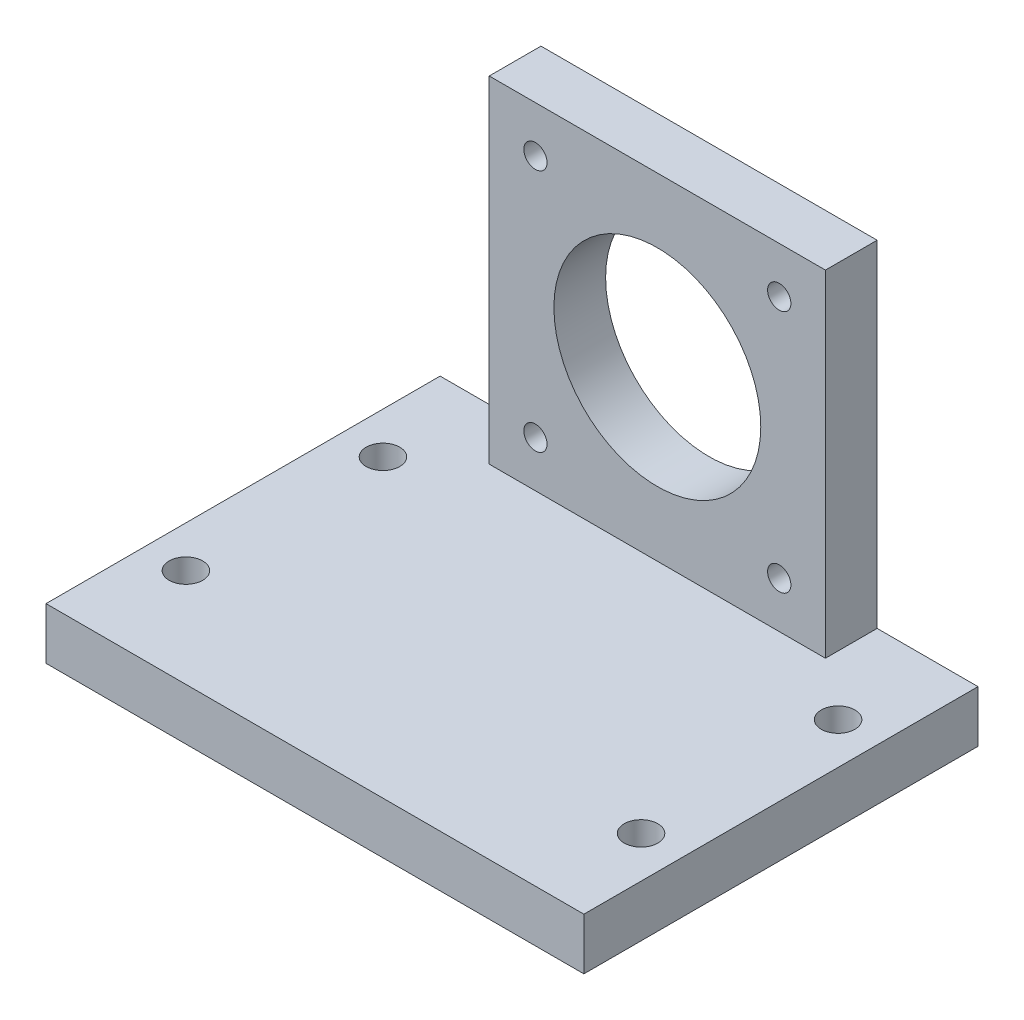
from build123d import *

# Parameters (mm, degrees)
SKETCH1_W                = 65
SKETCH1_H                = 65
SKETCH1_R                = 20
SKETCH1_R_2              = 2.25
BOSS_EXTRUDE1_DEPTH      = 10
BOSS_EXTRUDE2_DEPTH      = 66.2
BOSS_EXTRUDE2_DEPTH_BACK = 10
SKETCH3_R                = 3.25
CUT_EXTRUDE1_DEPTH       = 119.892556537


with BuildPart() as part:
    # Sketch1 → Boss-Extrude1 (new body)
    with BuildSketch(Plane.XY):
        Rectangle(SKETCH1_W, SKETCH1_H)
        Circle(SKETCH1_R, mode=Mode.SUBTRACT)
        with Locations((23.57, 23.57)):
            Circle(SKETCH1_R_2, mode=Mode.SUBTRACT)
        with Locations((-23.57, 23.57)):
            Circle(SKETCH1_R_2, mode=Mode.SUBTRACT)
        with Locations((-23.57, -23.57)):
            Circle(SKETCH1_R_2, mode=Mode.SUBTRACT)
        with Locations((23.57, -23.57)):
            Circle(SKETCH1_R_2, mode=Mode.SUBTRACT)
    extrude(amount=BOSS_EXTRUDE1_DEPTH)

    # Sketch2 → Boss-Extrude2 (add, two sides: drawn at the far end of the back side and taken through both)
    with BuildSketch(Plane.XY.offset(10).offset(-BOSS_EXTRUDE2_DEPTH_BACK)):
        Polygon((0, -32.5), (-52, -32.5), (-52, -42.5), (52, -42.5), (52, -32.5), align=None)
    extrude(amount=BOSS_EXTRUDE2_DEPTH + BOSS_EXTRUDE2_DEPTH_BACK)

    # Sketch3 → Cut-Extrude1 (cut, through all)
    with BuildSketch(Plane.XZ.offset(42.5)):
        with Locations((44, 19.05)):
            Circle(SKETCH3_R)
        with Locations((-44, 19.05)):
            Circle(SKETCH3_R)
        with Locations((-44, 57.15)):
            Circle(SKETCH3_R)
        with Locations((44, 57.15)):
            Circle(SKETCH3_R)
    extrude(amount=-CUT_EXTRUDE1_DEPTH, mode=Mode.SUBTRACT)


solid = part.part
